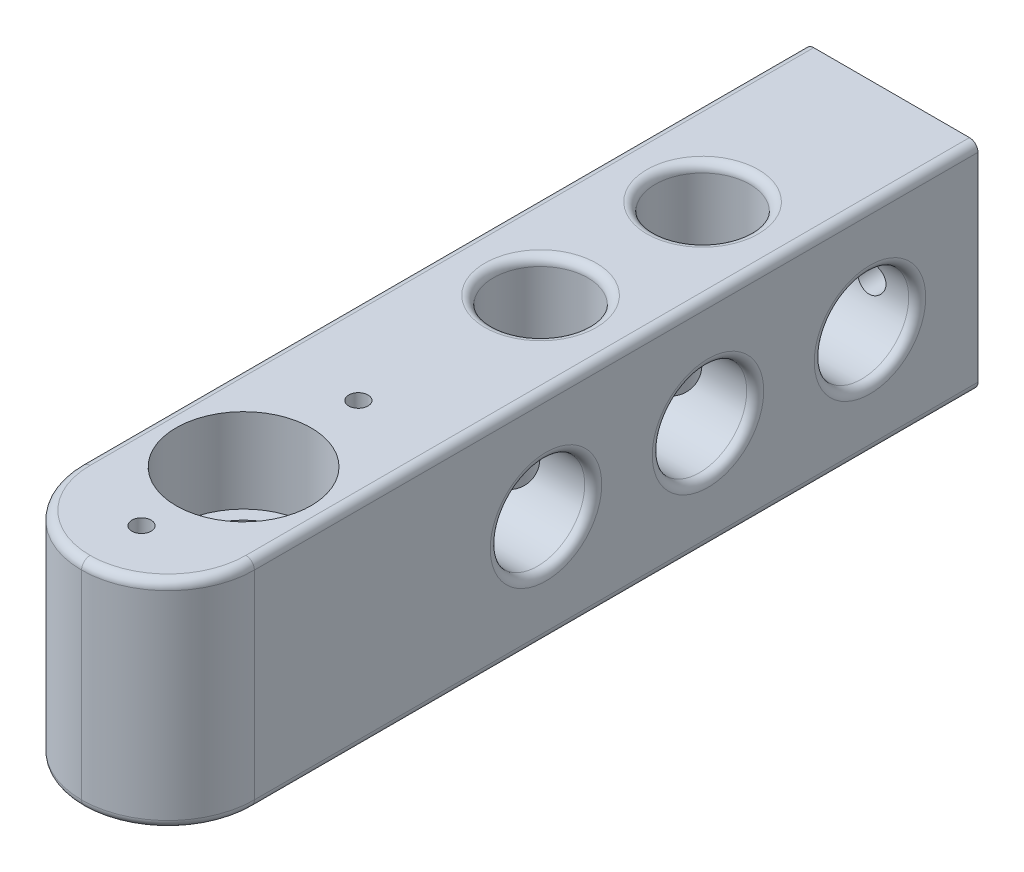
from build123d import *

# Parameters (mm, degrees)
SKETCH2_W                                = 20.32
SKETCH2_H                                = 25.399669802
BODY_DEPTH                               = 95.25
SKETCH3_R                                = 5
YAW_AXLE_OPENING_DEPTH                   = 100.100612138
TOP_START                                = -9.92251
SKETCH3_3_R                              = 6.35
SKETCH3_3_R_2                            = 5
TOP_YAW_BEARING_DEPTH                    = 3.96748
LOWER_START                              = -21.43252
SKETCH3_4_R                              = 6.35
SKETCH3_4_R_2                            = 5
LOWER_YAW_BEARING_DEPTH                  = 3.96748
SKETCH5_R                                = 7.9375
YAW_AXLE_CAP_RECESS_DEPTH                = 9.92251
F_4_40_TAPPED_HOLE1_D                    = 2.2606
F_4_40_TAPPED_HOLE1_DEPTH                = 5.08
F_4_40_TAPPED_HOLE1_TIP                  = 0.679152758
F_8_32_TAPPED_HOLE1_D                    = 3.4544
F_8_32_TAPPED_HOLE1_DEPTH                = 10.70864
F_8_32_TAPPED_HOLE1_TIP                  = 1.037806461
F_6_32_TAPPED_HOLE2_D                    = 2.7051
F_6_32_TAPPED_HOLE2_DEPTH                = 5.08
F_6_32_TAPPED_HOLE2_TIP                  = 0.81269403
F_7_16_0_4375_DIAMETER_HOLE1_D           = 11.1125
F_7_16_0_4375_DIAMETER_HOLE1_ON_FACE_2_D = 11.1125
FILLET1_R                                = 10.16
FILLET3_R                                = 1


with BuildPart() as part:
    # Sketch2 → Body (new body)
    with BuildSketch(Plane.XY):
        Rectangle(SKETCH2_W, SKETCH2_H)
    extrude(amount=BODY_DEPTH)

    # Sketch3 → Yaw Axle Opening (cut, through all)
    with BuildSketch(Plane(origin=(0, 12.699834901, 0), x_dir=(1, 0, 0), z_dir=(0, 1, 0))):
        with Locations(Location((0, -76.2, 0), (0, 0, 270))):
            Circle(SKETCH3_R)
        with BuildLine():
            ThreePointArc((5, -76.2), (3.535533906, -72.664466094), (0, -71.2))
            Line((0, -71.2), (0, -81.2))
            ThreePointArc((0, -81.2), (3.535533906, -79.735533906), (5, -76.2))
        make_face()
        with BuildLine():
            Line((0, -81.2), (0, -71.2))
            ThreePointArc((0, -71.2), (-5, -76.2), (0, -81.2))
        make_face()
    extrude(amount=-YAW_AXLE_OPENING_DEPTH, mode=Mode.SUBTRACT)

    # Sketch3<3> → Top Yaw Bearing (cut)
    with BuildSketch(Plane(origin=(0, 12.699834901, 0), x_dir=(1, 0, 0), z_dir=(0, 1, 0)).offset(TOP_START)):
        with Locations(Location((0, -76.2, 0), (0, 0, 270))):
            Circle(SKETCH3_3_R)
        with Locations(Location((0, -76.2, 0), (0, 0, 270))):
            Circle(SKETCH3_3_R_2, mode=Mode.SUBTRACT)
    extrude(amount=-TOP_YAW_BEARING_DEPTH, mode=Mode.SUBTRACT)

    # Sketch3<4> → Lower Yaw Bearing (cut)
    with BuildSketch(Plane(origin=(0, 12.699834901, 0), x_dir=(1, 0, 0), z_dir=(0, 1, 0)).offset(LOWER_START)):
        with Locations(Location((0, -76.2, 0), (0, 0, 270))):
            Circle(SKETCH3_4_R)
        with Locations(Location((0, -76.2, 0), (0, 0, 270))):
            Circle(SKETCH3_4_R_2, mode=Mode.SUBTRACT)
    extrude(amount=-LOWER_YAW_BEARING_DEPTH, mode=Mode.SUBTRACT)

    # Sketch5 → Yaw Axle Cap Recess (cut)
    with BuildSketch(Plane(origin=(0, 12.699834901, 0), x_dir=(1, 0, 0), z_dir=(0, 1, 0))):
        with Locations(Location((0, -76.2, 0), (0, 0, 270))):
            Circle(SKETCH5_R)
    extrude(amount=-YAW_AXLE_CAP_RECESS_DEPTH, mode=Mode.SUBTRACT)

    # #4-40 Tapped Hole1
    with Locations(Plane(origin=(0, 12.699834901, 62.7), x_dir=(1, 0, 0), z_dir=(0, 1, 0))):
        with Locations((0, 0), (0, -25.5)):
            Hole(F_4_40_TAPPED_HOLE1_D / 2, depth=F_4_40_TAPPED_HOLE1_DEPTH)
            with Locations((0, 0, -(F_4_40_TAPPED_HOLE1_DEPTH + F_4_40_TAPPED_HOLE1_TIP / 2))):  # 118° drill point
                Cone(0, F_4_40_TAPPED_HOLE1_D / 2, F_4_40_TAPPED_HOLE1_TIP, mode=Mode.SUBTRACT)

    # #8-32 Tapped Hole1
    with Locations(Plane(origin=(4.7625, 0, 0), x_dir=(-1, 0, 0), z_dir=(0, 0, -1))):
        with Locations((0, 0), (9.525, 0)):
            Hole(F_8_32_TAPPED_HOLE1_D / 2, depth=F_8_32_TAPPED_HOLE1_DEPTH)
            with Locations((0, 0, -(F_8_32_TAPPED_HOLE1_DEPTH + F_8_32_TAPPED_HOLE1_TIP / 2))):  # 118° drill point
                Cone(0, F_8_32_TAPPED_HOLE1_D / 2, F_8_32_TAPPED_HOLE1_TIP, mode=Mode.SUBTRACT)

    # #6-32 Tapped Hole2
    with Locations(Plane(origin=(-5.938258793, -12.699834901, -21.918133201), x_dir=(1, 0, 0), z_dir=(0, -1, 0))):
        with Locations((5.938258793, 72.718133201)):
            Hole(F_6_32_TAPPED_HOLE2_D / 2, depth=F_6_32_TAPPED_HOLE2_DEPTH)
            with Locations((0, 0, -(F_6_32_TAPPED_HOLE2_DEPTH + F_6_32_TAPPED_HOLE2_TIP / 2))):  # 118° drill point
                Cone(0, F_6_32_TAPPED_HOLE2_D / 2, F_6_32_TAPPED_HOLE2_TIP, mode=Mode.SUBTRACT)

    # 7/16 (0.4375) Diameter Hole1 (through all)
    with Locations(Plane(origin=(-10.16, 0, 12.7), x_dir=(0, -1, 0), z_dir=(-1, 0, 0))):
        with Locations((0, 0), (0, 19.05), (0, 38.1)):
            Hole(F_7_16_0_4375_DIAMETER_HOLE1_D / 2)

    # 7/16 (0.4375) Diameter Hole1 on face 2 (through all)
    with Locations(Plane(origin=(0, 12.699834901, 22.225), x_dir=(0, 0, 1), z_dir=(0, 1, 0))):
        with Locations((0, 0), (19.05, 0)):
            Hole(F_7_16_0_4375_DIAMETER_HOLE1_ON_FACE_2_D / 2)

    # Fillet1
    fillet1_edges = [part.edges().sort_by_distance(p)[0] for p in [
        (-10.16, 0, 95.25),
        (10.16, 0, 95.25),
    ]]
    fillet(fillet1_edges, radius=FILLET1_R - 0.0001)  # a hair under: the kernel refuses the full size

    # Fillet3
    fillet3_edges = [part.edges().sort_by_distance(p)[0] for p in [
        (10.16, 12.699834901, 42.54505),
        (7.184234186, 12.699834901, 92.274234186),
        (-7.184234186, 12.699834901, 92.274234186),
        (0, 12.699834901, 46.83125),
        (0, -12.699834901, 46.83125),
        (0, 12.699834901, 27.78125),
        (0, -12.699834901, 27.78125),
        (10.16, -5.55625, 50.8),
        (-10.16, -5.55625, 50.8),
        (10.16, -5.55625, 31.75),
        (-10.16, -5.55625, 31.75),
        (10.16, -5.55625, 12.7),
        (-10.16, -5.55625, 12.7),
        (10.16, -12.699834901, 42.54505),
        (-10.16, -12.699834901, 42.54505),
        (7.184234186, -12.699834901, 92.274234186),
        (-7.184234186, -12.699834901, 92.274234186),
        (-10.16, 12.699834901, 42.54505),
    ]]
    fillet(fillet3_edges, radius=FILLET3_R)


solid = part.part
